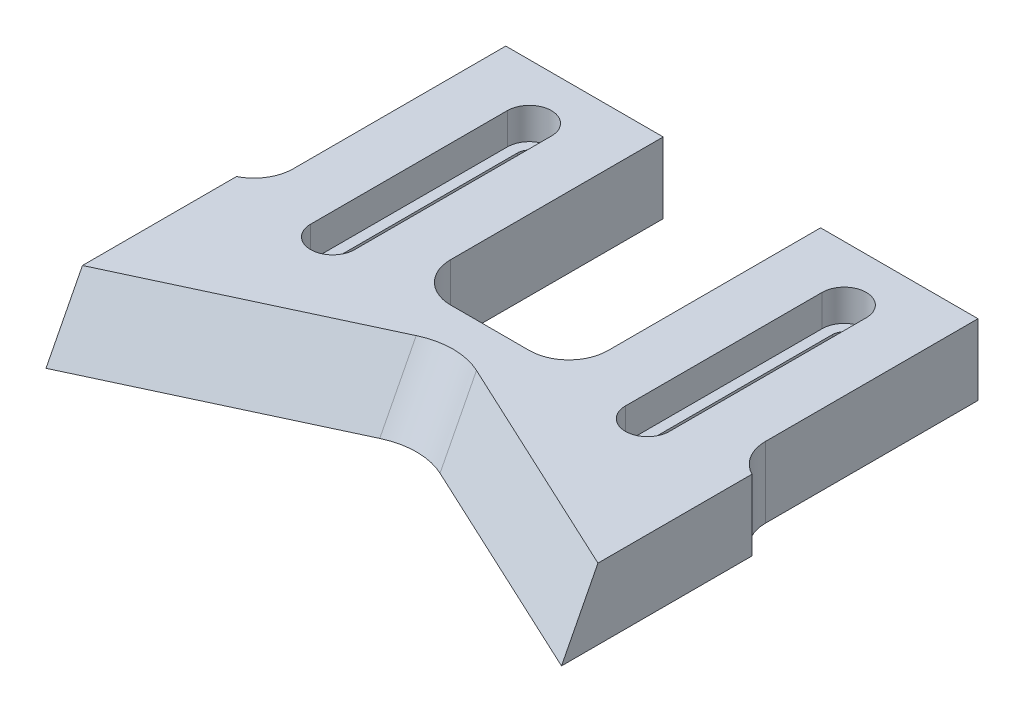
from build123d import *

# Parameters (mm, degrees)
BOSS_EXTRUDE1_DEPTH = 9
CUT_EXTRUDE2_REACH  = 97.631
SKETCH5_W           = 20
SKETCH5_H           = 32
SKETCH5_W_2         = 7.75
CUT_EXTRUDE3_DEPTH  = 10
FILLET1_R           = 5
CUT_EXTRUDE4_DEPTH  = 4
CHAMFER1_SIZE       = 9
CHAMFER1_SIZE_2     = 4.196768923
FILLET2_R           = 10
CUT_EXTRUDE5_REACH  = 97.631
SKETCH7_W           = 5
SKETCH7_H           = 33.085129134
SKETCH7_H_2         = 33.745309592


with BuildPart() as part:
    # Sketch1 → Boss-Extrude1 (new body)
    with BuildSketch(Plane(origin=(0, 0, 0), x_dir=(1, 0, 0), z_dir=(0, 1, 0))):
        Polygon((0, 0), (0, 58), (75.5, 58), (75.5, 0), (37.75, 17.603114095), align=None)
    extrude(amount=BOSS_EXTRUDE1_DEPTH)

    # Sketch4 → Cut-Extrude2 (cut, up to next)
    with BuildSketch(Plane(origin=(0, 9, 0), x_dir=(1, 0, 0), z_dir=(0, 1, 0)), mode=Mode.PRIVATE) as cut_extrude2_sk1:
        with BuildLine():
            Line((19.25, 51), (19.25, 26))
            ThreePointArc((19.25, 26), (17.75, 24.5), (16.25, 26))
            Line((16.25, 26), (16.25, 51))
            ThreePointArc((16.25, 51), (17.75, 52.5), (19.25, 51))
        make_face()
    cut_extrude2_tool1 = extrude(cut_extrude2_sk1.sketch, amount=-CUT_EXTRUDE2_REACH, mode=Mode.PRIVATE) & part.part
    # Sketch4 → Cut-Extrude2 (cut, up to next)
    with BuildSketch(Plane(origin=(0, 9, 0), x_dir=(1, 0, 0), z_dir=(0, 1, 0)), mode=Mode.PRIVATE) as cut_extrude2_sk2:
        with BuildLine():
            Line((59.25, 51), (59.25, 26))
            ThreePointArc((59.25, 26), (57.75, 24.5), (56.25, 26))
            Line((56.25, 26), (56.25, 51))
            ThreePointArc((56.25, 51), (57.75, 52.5), (59.25, 51))
        make_face()
    cut_extrude2_tool2 = extrude(cut_extrude2_sk2.sketch, amount=-CUT_EXTRUDE2_REACH, mode=Mode.PRIVATE) & part.part
    add(cut_extrude2_tool1.solids().sort_by_distance((17.75, 9, -38.5))[0], mode=Mode.SUBTRACT)
    add(cut_extrude2_tool2.solids().sort_by_distance((57.75, 9, -38.5))[0], mode=Mode.SUBTRACT)

    # Sketch5 → Cut-Extrude3 (cut)
    with BuildSketch(Plane(origin=(0, 9, 0), x_dir=(1, 0, 0), z_dir=(0, 1, 0))):
        with Locations((37.75, 42)):
            Rectangle(SKETCH5_W, SKETCH5_H)
        with Locations((71.625, 42)):
            Rectangle(SKETCH5_W_2, SKETCH5_H)
        with Locations((3.875, 42)):
            Rectangle(SKETCH5_W_2, SKETCH5_H)
    extrude(amount=-CUT_EXTRUDE3_DEPTH, mode=Mode.SUBTRACT)

    # Fillet1
    fillet1_edges = [part.edges().sort_by_distance(p)[0] for p in [
        (27.75, 4.5, -26),
        (47.75, 4.5, -26),
        (7.75, 4.5, -26),
        (67.75, 4.5, -26),
    ]]
    fillet(fillet1_edges, radius=FILLET1_R)

    # Sketch6 → Cut-Extrude4 (cut)
    with BuildSketch(Plane(origin=(0, 9, 0), x_dir=(1, 0, 0), z_dir=(0, 1, 0))):
        with BuildLine():
            Line((20.55, 51), (20.55, 26))
            ThreePointArc((20.55, 26), (17.75, 23.2), (14.95, 26))
            Line((14.95, 26), (14.95, 51))
            ThreePointArc((14.95, 51), (17.75, 53.8), (20.55, 51))
        make_face()
        with BuildLine():
            Line((60.55, 51), (60.55, 26))
            ThreePointArc((60.55, 26), (57.75, 23.2), (54.95, 26))
            Line((54.95, 26), (54.95, 51))
            ThreePointArc((54.95, 51), (57.75, 53.8), (60.55, 51))
        make_face()
    extrude(amount=-CUT_EXTRUDE4_DEPTH, mode=Mode.SUBTRACT)

    # Chamfer1
    # the kernel refuses this chamfer: 9, 4.196768923 mm, written as the material it takes off along each edge
    with BuildSketch(Plane(origin=(96.633991212, 9, 9.85494195), x_dir=(-0.006893395832057369, -0.9998669641130703, 0.014782935067658582), z_dir=(-0.9063077870366479, 0, -0.42261826174070394))) as chamfer1_piece_1_section:
        Polygon((CHAMFER1_SIZE * 0.999866964113, -CHAMFER1_SIZE * 0.0163111641311), (-CHAMFER1_SIZE_2 * 0.0163111641326, -CHAMFER1_SIZE_2 * 0.999866964207), (0, 0), align=None)
    chamfer1_piece_1 = extrude(amount=88.290074926, mode=Mode.PRIVATE)
    chamfer1_piece_1 = split(chamfer1_piece_1, bisect_by=Plane(origin=(57.902621458, 5.937801532, -27.000435813), z_dir=(0.42261826174070394, 0, 0.9063077870366479)), keep=Keep.TOP, mode=Mode.PRIVATE)
    add(chamfer1_piece_1, mode=Mode.SUBTRACT)
    with BuildSketch(Plane(origin=(58.883991212, 9, -27.458056045), x_dir=(0.006893395832057004, -0.9998669641130703, 0.014782935067657803), z_dir=(-0.9063077870366479, 0, 0.42261826174070394))) as chamfer1_piece_2_section:
        Polygon((CHAMFER1_SIZE * 0.999866964113, -CHAMFER1_SIZE * 0.0163111641311), (-CHAMFER1_SIZE_2 * 0.0163111641326, -CHAMFER1_SIZE_2 * 0.999866964207), (0, 0), align=None)
    chamfer1_piece_2 = extrude(amount=88.290074926, mode=Mode.PRIVATE)
    chamfer1_piece_2 = split(chamfer1_piece_2, bisect_by=Plane(origin=(17.597378542, 5.937801532, -27.000435813), z_dir=(-0.42261826174070394, 0, 0.9063077870366479)), keep=Keep.TOP, mode=Mode.PRIVATE)
    add(chamfer1_piece_2, mode=Mode.SUBTRACT)
    with BuildSketch(Plane(origin=(96.633991212, 9, 9.85494195), x_dir=(-0.006893395832057369, -0.9998669641130703, 0.014782935067658582), z_dir=(-0.9063077870366479, 0, -0.42261826174070394))) as chamfer1_piece_3a_section:
        Polygon((CHAMFER1_SIZE * 0.999866964113, -CHAMFER1_SIZE * 0.0163111641311), (-CHAMFER1_SIZE_2 * 0.0163111641326, -CHAMFER1_SIZE_2 * 0.999866964207), (0, 0), align=None)
    chamfer1_piece_3a = extrude(amount=88.290074926, mode=Mode.PRIVATE)
    chamfer1_piece_3a = split(chamfer1_piece_3a, bisect_by=Plane(origin=(32.238129018, 6.0031385, -15.032886446), z_dir=(-0.42261826174070394, 0, -0.9063077870366479)), keep=Keep.TOP, mode=Mode.PRIVATE)
    with BuildSketch(Plane(origin=(58.883991212, 9, -27.458056045), x_dir=(0.006893395832057004, -0.9998669641130703, 0.014782935067657803), z_dir=(-0.9063077870366479, 0, 0.42261826174070394))) as chamfer1_piece_3b_section:
        Polygon((CHAMFER1_SIZE * 0.999866964113, -CHAMFER1_SIZE * 0.0163111641311), (-CHAMFER1_SIZE_2 * 0.0163111641326, -CHAMFER1_SIZE_2 * 0.999866964207), (0, 0), align=None)
    chamfer1_piece_3b = extrude(amount=88.290074926, mode=Mode.PRIVATE)
    chamfer1_piece_3b = split(chamfer1_piece_3b, bisect_by=Plane(origin=(43.261870982, 6.0031385, -15.032886446), z_dir=(0.42261826174070394, 0, -0.9063077870366479)), keep=Keep.TOP, mode=Mode.PRIVATE)
    chamfer1_piece_3 = chamfer1_piece_3a & chamfer1_piece_3b
    add(chamfer1_piece_3, mode=Mode.SUBTRACT)

    # Fillet2
    fillet2_edges = [part.edges().sort_by_distance(p)[0] for p in [
        (37.75, 4.5, -19.918425176),
    ]]
    fillet(fillet2_edges, radius=FILLET2_R)

    # Sketch7 → Cut-Extrude5 (cut, up to next)
    with BuildSketch(Plane(origin=(0, 9, 0), x_dir=(1, 0, 0), z_dir=(0, 1, 0)), mode=Mode.PRIVATE) as cut_extrude5_sk1:
        with Locations((2.5, 16.542564567)):
            Rectangle(SKETCH7_W, SKETCH7_H)
    cut_extrude5_tool1 = extrude(cut_extrude5_sk1.sketch, amount=-CUT_EXTRUDE5_REACH, mode=Mode.PRIVATE) & part.part
    # Sketch7 → Cut-Extrude5 (cut, up to next)
    with BuildSketch(Plane(origin=(0, 9, 0), x_dir=(1, 0, 0), z_dir=(0, 1, 0)), mode=Mode.PRIVATE) as cut_extrude5_sk2:
        with Locations((73, 16.872654796)):
            Rectangle(SKETCH7_W, SKETCH7_H_2)
    cut_extrude5_tool2 = extrude(cut_extrude5_sk2.sketch, amount=-CUT_EXTRUDE5_REACH, mode=Mode.PRIVATE) & part.part
    add(cut_extrude5_tool1.solids().sort_by_distance((2.5, 9, -16.542565))[0], mode=Mode.SUBTRACT)
    add(cut_extrude5_tool2.solids().sort_by_distance((73, 9, -16.872655))[0], mode=Mode.SUBTRACT)


solid = part.part
